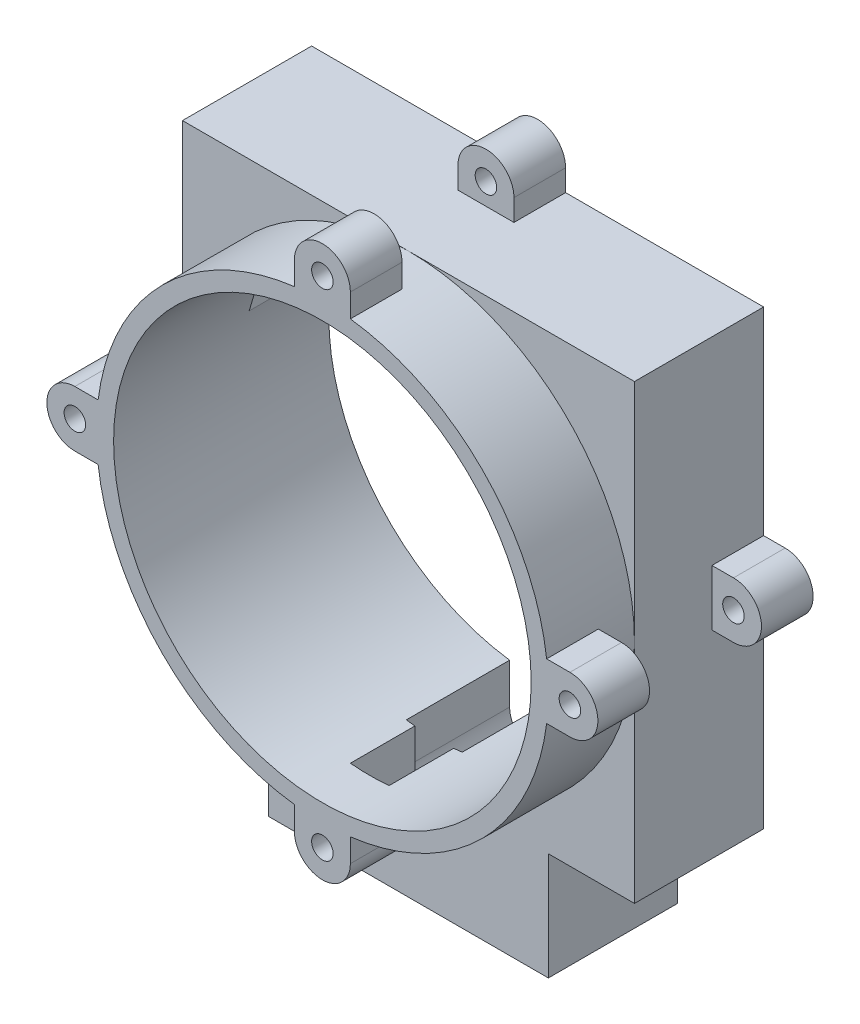
from build123d import *
from build123d.topology import SkipClean

# Parameters (mm, degrees)
SKETCH1_W                = 105
SKETCH1_H                = 105
SKETCH1_W_2              = 94
SKETCH1_H_2              = 94
SKETCH1_W_3              = 65
SKETCH1_H_3              = 25
BOSS_EXTRUDE1_DEPTH      = 20
SKETCH2_W                = 65
SKETCH2_H                = 25
SKETCH2_W_2              = 94
SKETCH2_H_2              = 94
BOSS_EXTRUDE2_DEPTH      = 10
SKETCH3_W                = 57
SKETCH3_H                = 26.5
CUT_EXTRUDE1_DEPTH       = 20
SKETCH5_R                = 52.5
BOSS_EXTRUDE4_DEPTH      = 20
SKETCH8_R                = 48.5
CUT_EXTRUDE3_DEPTH       = 107.124926384
BOSS_EXTRUDE5_START      = -38
SKETCH9_R                = 2.5
BOSS_EXTRUDE5_DEPTH      = 12
SKETCH4_R                = 2.5
BOSS_EXTRUDE6_DEPTH      = 20
SKETCH10_W               = 15.5
SKETCH10_H               = 26.597794237
CUT_EXTRUDE4_DEPTH       = 20
BOSS_EXTRUDE8_START      = -45
SKETCH11_R               = 2.5
BOSS_EXTRUDE8_DEPTH      = 15
BOSS_EXTRUDE7_DEPTH      = 20
SKETCH16_R               = 2.5
BOSS_EXTRUDE9_DEPTH      = 30
CUT_EXTRUDE5_START       = -8
CUT_EXTRUDE5_DEPTH       = 8
SKETCH18_R               = 2.5
BOSS_EXTRUDE10_DEPTH     = 12
CUT_EXTRUDE12_DEPTH      = 18
CUT_EXTRUDE12_DEPTH_BACK = 24
CUT_EXTRUDE13_DEPTH      = 15


# Read off the part's stored shape, not the designer's step: Boss-Extrude7
with BuildPart() as part:
    # Sketch1 → Boss-Extrude1 (new body)
    # profile 1 of 2: a face of its own
    with BuildSketch(Plane.XY):
        Rectangle(SKETCH1_W, SKETCH1_H)
        Rectangle(SKETCH1_W_2, SKETCH1_H_2, mode=Mode.SUBTRACT)
    # profile 2 of 2: a face of its own
    with BuildSketch(Plane.XY):
        with Locations((0, -65)):
            Rectangle(SKETCH1_W_3, SKETCH1_H_3)
    extrude(amount=BOSS_EXTRUDE1_DEPTH)

    # Sketch2 → Boss-Extrude2 (add)
    # profile 1 of 3: a face of its own
    with BuildSketch(Plane.XY.offset(20)):
        with Locations((0, -65)):
            Rectangle(SKETCH2_W, SKETCH2_H)
    # profile 2 of 3: a face of its own
    with BuildSketch(Plane.XY.offset(20)):
        Polygon((52.5, 52.5), (-52.5, 52.5), (-52.5, -52.5), (-32.5, -52.5), (32.5, -52.5), (52.5, -52.5), align=None)
        Rectangle(SKETCH2_W_2, SKETCH2_H_2, mode=Mode.SUBTRACT)
    # profile 3 of 3: a face of its own
    with BuildSketch(Plane.XY.offset(20)):
        Rectangle(SKETCH2_W_2, SKETCH2_H_2)
    extrude(amount=BOSS_EXTRUDE2_DEPTH)

    # Sketch3 → Cut-Extrude1 (cut)
    with BuildSketch(Plane(origin=(0, 0, 0), x_dir=(-1, 0, 0), z_dir=(0, 0, -1))):
        with Locations((0, -60.25)):
            Rectangle(SKETCH3_W, SKETCH3_H)
    extrude(amount=-CUT_EXTRUDE1_DEPTH, mode=Mode.SUBTRACT)

    # Sketch5 → Boss-Extrude4 (add)
    with BuildSketch(Plane.XY.offset(30)):
        Circle(SKETCH5_R)
    extrude(amount=BOSS_EXTRUDE4_DEPTH)

    # Sketch8 → Cut-Extrude3 (cut, through all)
    with BuildSketch(Plane.XY.offset(50)):
        Circle(SKETCH8_R)
    extrude(amount=-CUT_EXTRUDE3_DEPTH, mode=Mode.SUBTRACT)

    # Sketch9 → Boss-Extrude5 (add)
    # profile 1 of 3: a face of its own
    with BuildSketch(Plane.XY.offset(50).offset(BOSS_EXTRUDE5_START)):
        with BuildLine():
            Line((57.5, 6.5), (48.5, 6.5))
            Line((48.5, 6.5), (48.5, -6.5))
            Line((48.5, -6.5), (57.5, -6.5))
            ThreePointArc((57.5, -6.5), (64, 0), (57.5, 6.5))
        make_face()
        with Locations((57.5, 0)):
            Circle(SKETCH9_R, mode=Mode.SUBTRACT)
    # profile 2 of 3: a face of its own
    with BuildSketch(Plane.XY.offset(50).offset(BOSS_EXTRUDE5_START)):
        with BuildLine():
            Line((-57.5, 6.5), (-48.5, 6.5))
            Line((-48.5, 6.5), (-48.5, -6.5))
            Line((-48.5, -6.5), (-57.5, -6.5))
            ThreePointArc((-57.5, -6.5), (-64, 0), (-57.5, 6.5))
        make_face()
        with Locations((-57.5, 0)):
            Circle(SKETCH9_R, mode=Mode.SUBTRACT)
    # profile 3 of 3: a face of its own
    with BuildSketch(Plane.XY.offset(50).offset(BOSS_EXTRUDE5_START)):
        with BuildLine():
            Line((-6.5, 57.5), (-6.5, 48.5))
            Line((-6.5, 48.5), (6.5, 48.5))
            Line((6.5, 48.5), (6.5, 57.5))
            ThreePointArc((6.5, 57.5), (0, 64), (-6.5, 57.5))
        make_face()
        with Locations((0, 57.5)):
            Circle(SKETCH9_R, mode=Mode.SUBTRACT)
    extrude(amount=-BOSS_EXTRUDE5_DEPTH)

    # Sketch4 → Boss-Extrude6 (add)
    with BuildSketch(Plane(origin=(0, 0, 0), x_dir=(-1, 0, 0), z_dir=(0, 0, -1))):
        with BuildLine():
            Line((-32.5, -64), (-32.5, -77.5))
            Line((-32.5, -77.5), (32.5, -77.5))
            Line((32.5, -77.5), (32.5, -64))
            Line((32.5, -64), (37.5, -64))
            ThreePointArc((37.5, -64), (42.096194078, -62.096194078), (44, -57.5))
            Line((44, -57.5), (44, -52.5))
            Line((44, -52.5), (52.5, -52.5))
            Line((52.5, -52.5), (52.021296507, -7.073521736))
            ThreePointArc((52.021296507, -7.073521736), (49.206713639, -18.301621043), (44, -28.640006983))
            Line((44, -28.640006983), (44, -20.402205763))
            ThreePointArc((44, -20.402205763), (0, -48.5), (-44, -20.402205763))
            Line((-44, -20.402205763), (-44, -28.640006983))
            ThreePointArc((-44, -28.640006983), (-50.330159944, -14.937369246), (-52.5, 0))
            Line((-52.5, 0), (-52.5, -52.5))
            Line((-52.5, -52.5), (-44, -52.5))
            Line((-44, -52.5), (-44, -57.5))
            ThreePointArc((-44, -57.5), (-42.096194078, -62.096194078), (-37.5, -64))
            Line((-37.5, -64), (-32.5, -64))
        make_face()
        with Locations((-37.5, -57.5)):
            Circle(SKETCH4_R, mode=Mode.SUBTRACT)
        with Locations((37.5, -57.5)):
            Circle(SKETCH4_R, mode=Mode.SUBTRACT)
    extrude(amount=-BOSS_EXTRUDE6_DEPTH)

    # Sketch10 → Cut-Extrude4 (cut)
    with BuildSketch(Plane(origin=(0, 0, 0), x_dir=(-1, 0, 0), z_dir=(0, 0, -1))):
        with Locations((-36.25, -33.701102881)):
            Rectangle(SKETCH10_W, SKETCH10_H)
        with Locations((37.754368076, -33.701102881)):
            Rectangle(SKETCH10_W, SKETCH10_H)
    extrude(amount=-CUT_EXTRUDE4_DEPTH, mode=Mode.SUBTRACT)

    # Sketch11 → Boss-Extrude8 (add)
    with BuildSketch(Plane.XY.offset(50).offset(BOSS_EXTRUDE8_START)):
        with Locations(Location((-37.5, -57.5, 0), (0, 0, 180))):
            Circle(SKETCH11_R)
        with Locations(Location((37.5, -57.5, 0), (0, 0, 180))):
            Circle(SKETCH11_R)
    extrude(amount=BOSS_EXTRUDE8_DEPTH)

    # Boss-Extrude7 outline → Boss-Extrude7 (add)
    with SkipClean():  # the faces are left unmerged after this step: merging them gives an invalid solid
        with BuildSketch(Plane.XY):
            with BuildLine():
                ThreePointArc((-30.004368076, -38.104958947), (-40.659489217, -26.439665971), (-47, -11.968709204))
                Line((-47, -11.968709204), (-47, -23.393375131))
                ThreePointArc((-47, -23.393375131), (-46.273225972, -24.79997093), (-45.504368076, -26.18401203))
                Line((-45.504368076, -26.18401203), (-45.504368076, -47))
                Line((-45.504368076, -47), (-30.004368076, -47))
                Line((-30.004368076, -47), (-30.004368076, -38.104958947))
            make_face()
            with BuildLine():
                Line((47, -23.393375131), (47, -11.968709204))
                ThreePointArc((47, -11.968709204), (40.137662704, -27.225319699), (28.5, -39.242833741))
                Line((28.5, -39.242833741), (28.5, -47))
                Line((28.5, -47), (44, -47))
                Line((44, -47), (44, -28.640006983))
                ThreePointArc((44, -28.640006983), (45.575561285, -26.059896653), (47, -23.393375131))
            make_face()
        extrude(amount=BOSS_EXTRUDE7_DEPTH)

    # Sketch16 → Boss-Extrude9 (add)
    with SkipClean():  # the faces are left unmerged after this step: merging them gives an invalid solid
        with BuildSketch(Plane.XY.offset(20)):
            with BuildLine():
                Line((-6.5, -57.496065111), (-6.5, -52.096065111))
                ThreePointArc((-6.5, -52.096065111), (0, -52.5), (6.5, -52.096065111))
                Line((6.5, -52.096065111), (6.5, -57.496065111))
                ThreePointArc((6.5, -57.496065111), (0, -63.996065111), (-6.5, -57.496065111))
            make_face()
            with Locations(Location((0, -57.496065111, 0), (0, 0, 180))):
                Circle(SKETCH16_R, mode=Mode.SUBTRACT)
        extrude(amount=BOSS_EXTRUDE9_DEPTH)

    # Sketch17 → Cut-Extrude5 (cut)
    with SkipClean():  # the faces are left unmerged after this step: merging them gives an invalid solid
        with BuildSketch(Plane.XY.offset(20).offset(CUT_EXTRUDE5_START)):
            with BuildLine():
                Line((32.5, -64), (32.5, -52.5))
                Line((32.5, -52.5), (44, -52.5))
                Line((44, -52.5), (44, -57.5))
                ThreePointArc((44, -57.5), (42.096194078, -62.096194078), (37.5, -64))
                Line((37.5, -64), (32.5, -64))
            make_face()
            with BuildLine():
                Line((-44, -52.5), (-32.5, -52.5))
                Line((-32.5, -52.5), (-32.5, -64))
                Line((-32.5, -64), (-37.5, -64))
                ThreePointArc((-37.5, -64), (-42.096194078, -62.096194078), (-44, -57.5))
                Line((-44, -57.5), (-44, -52.5))
            make_face()
        extrude(amount=CUT_EXTRUDE5_DEPTH, mode=Mode.SUBTRACT)

    # Sketch18 → Boss-Extrude10 (add)
    # profile 1 of 3: a face of its own
    with SkipClean():  # the faces are left unmerged after this step: merging them gives an invalid solid
        with BuildSketch(Plane.XY.offset(50)):
            with BuildLine():
                Line((-57.5, 6.5), (-52.096065111, 6.5))
                ThreePointArc((-52.096065111, 6.5), (-52.5, 0), (-52.096065111, -6.5))
                Line((-52.096065111, -6.5), (-57.5, -6.5))
                ThreePointArc((-57.5, -6.5), (-64, 0), (-57.5, 6.5))
            make_face()
            with Locations((-57.5, 0)):
                Circle(SKETCH18_R, mode=Mode.SUBTRACT)
        # profile 2 of 3: a face of its own
        with BuildSketch(Plane.XY.offset(50)):
            with BuildLine():
                Line((52.096065111, 6.5), (57.5, 6.5))
                ThreePointArc((57.5, 6.5), (64, 0), (57.5, -6.5))
                Line((57.5, -6.5), (52.096065111, -6.5))
                ThreePointArc((52.096065111, -6.5), (52.5, 0), (52.096065111, 6.5))
            make_face()
            with Locations((57.5, 0)):
                Circle(SKETCH18_R, mode=Mode.SUBTRACT)
        # profile 3 of 3: a face of its own
        with BuildSketch(Plane.XY.offset(50)):
            with BuildLine():
                Line((-6.5, 57.5), (-6.5, 52.096065111))
                ThreePointArc((-6.5, 52.096065111), (0, 52.5), (6.5, 52.096065111))
                Line((6.5, 52.096065111), (6.5, 57.5))
                ThreePointArc((6.5, 57.5), (0, 64), (-6.5, 57.5))
            make_face()
            with Locations((0, 57.5)):
                Circle(SKETCH18_R, mode=Mode.SUBTRACT)
        extrude(amount=-BOSS_EXTRUDE10_DEPTH)

    # Sketch19 → Cut-Extrude12 (cut, two sides: drawn at the far end of the back side and taken through both)
    with SkipClean():  # the faces are left unmerged after this step: merging them gives an invalid solid
        with BuildSketch(Plane(origin=(0, 0, 0), x_dir=(-1, 0, 0), z_dir=(0, 0, -1)).offset(-CUT_EXTRUDE12_DEPTH_BACK)):
            with BuildLine():
                Line((-6.5, -57.496065111), (-6.5, -46.382922992))
                ThreePointArc((-6.5, -46.382922992), (0, -46.836156389), (6.5, -46.382922992))
                Line((6.5, -46.382922992), (6.5, -57.496065111))
                ThreePointArc((6.5, -57.496065111), (0, -63.996065111), (-6.5, -57.496065111))
            make_face()
        extrude(amount=CUT_EXTRUDE12_DEPTH + CUT_EXTRUDE12_DEPTH_BACK, mode=Mode.SUBTRACT)

    # Sketch20 → Cut-Extrude13 (cut)
    with SkipClean():  # the faces are left unmerged after this step: merging them gives an invalid solid
        with BuildSketch(Plane(origin=(0, 0, 24), x_dir=(-1, 0, 0), z_dir=(0, 0, -1))):
            with BuildLine():
                Line((4.5, -57.496065111), (4.5, -48.290785871))
                ThreePointArc((4.5, -48.290785871), (0, -48.5), (-4.5, -48.290785871))
                Line((-4.5, -48.290785871), (-4.5, -57.496065111))
                ThreePointArc((-4.5, -57.496065111), (0, -61.996065111), (4.5, -57.496065111))
            make_face()
        extrude(amount=-CUT_EXTRUDE13_DEPTH, mode=Mode.SUBTRACT)


solid = part.part
